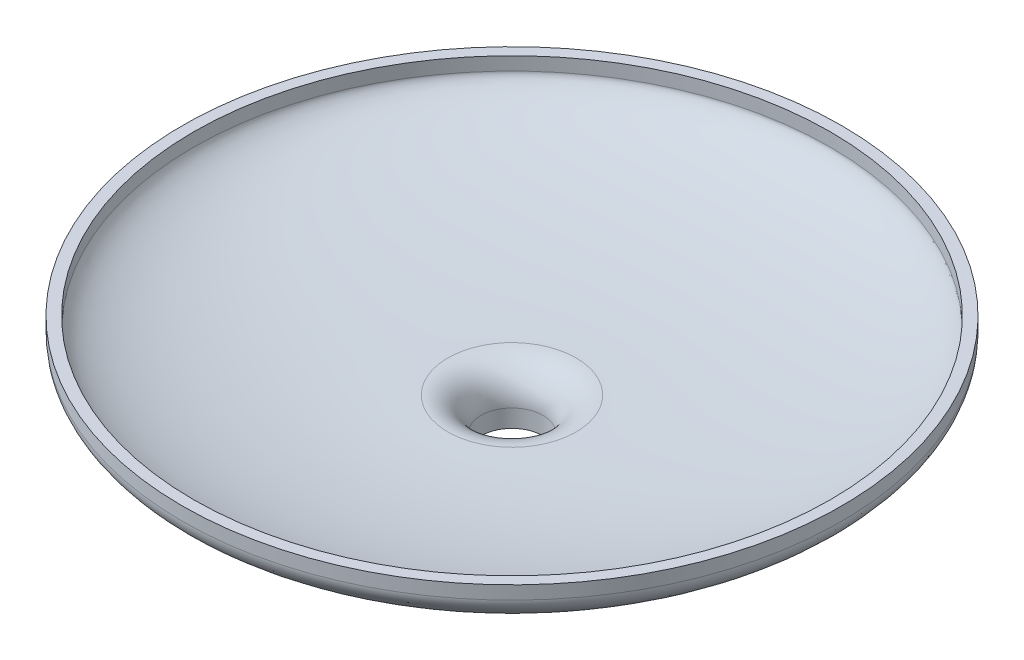
from build123d import *


with BuildPart() as part:
    # Sketch2 → Revolve1 (revolve)
    with BuildSketch(Plane.XY):
        with BuildLine():
            Line((-72, 23), (-72, 20))
            add(Edge.make_bspline(
                [(-72, 20), (-72, 19.914923829), (-71.984717939, 19.755669507), (-71.873545511, 19.360079456), (-71.490751952, 18.672542127), (-70.431687871, 17.593370328), (-68.177705093, 16.007333321), (-63.85638394, 13.968920518), (-56.605156719, 11.756834177), (-47.643396035, 9.916269969), (-37.355117126, 8.540821819), (-28.02346296, 7.83305458), (-20.330500811, 7.547743625), (-16.439976271, 7.5), (-14.5, 7.5)],
                knots=[3.141592654, 3.141592654, 3.141592654, 3.141592654, 3.190680039, 3.239767424, 3.337942194, 3.436116965, 3.534291735, 3.730641276, 3.926990817, 4.123340358, 4.319689899, 4.51603944, 4.61421421, 4.71238898, 4.71238898, 4.71238898, 4.71238898], degree=3))
            ThreePointArc((-14.5, 7.5), (-9.196699141, 5.303300859), (-7, 0))
            Line((-7, 0), (-7, -4))
            Line((-7, -4), (-9.5, -4))
            Line((-9.5, -4), (-9.5, 0))
            ThreePointArc((-9.5, 0), (-10.964466094, 3.535533906), (-14.5, 5))
            add(Edge.make_bspline(
                [(-74.5, 20), (-74.5, 5), (-14.5, 5)],
                knots=[3.141592654, 3.141592654, 3.141592654, 4.71238898, 4.71238898, 4.71238898], degree=2, weights=[1, 0.707106781, 1]))
            Line((-74.5, 20), (-74.5, 23))
            Line((-74.5, 23), (-72, 23))
        make_face()
    revolve(axis=Axis((0, 0, 0), (0, 1, 0)))


solid = part.part
